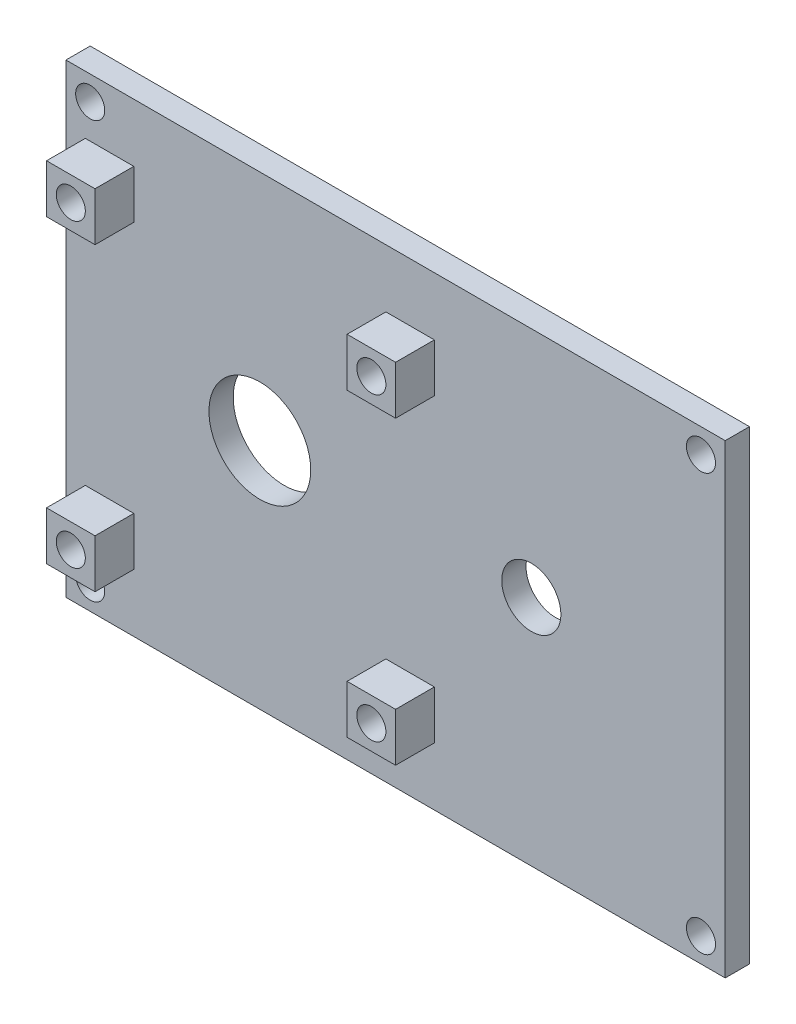
from build123d import *

# Parameters (mm, degrees)
SKICA1_R                 = 1.5
SKICA1_R_2               = 5.25
SKICA1_R_3               = 3.05
P_IDAT_VYSUNUT_M1_DEPTH  = 2.5
SKICA2_W                 = 5
SKICA2_H                 = 5
SKICA2_R                 = 1.5
P_IDAT_VYSUNUT_M2_DEPTH  = 4
ODEBRAT_START            = -2.5
SKICA5_R                 = 1.5
ODEBRAT_VYSUNUT_M1_DEPTH = 2.5
ZKOSEN_1_SIZE            = 1.5


with BuildPart() as part:
    # Skica1 → Přidat vysunutím1 (new body)
    with BuildSketch(Plane.XY):
        Polygon((-34, 9), (-34, -24), (34, -24), (34, 24), (-23.5, 24), (-34, 24), align=None)
        with Locations((-31.5, -21.5)):
            Circle(SKICA1_R, mode=Mode.SUBTRACT)
        with Locations((-14, 0)):
            Circle(SKICA1_R_2, mode=Mode.SUBTRACT)
        with Locations((31.5, -21.5)):
            Circle(SKICA1_R, mode=Mode.SUBTRACT)
        with Locations((14, 0)):
            Circle(SKICA1_R_3, mode=Mode.SUBTRACT)
        with Locations((-31.5, 21.5)):
            Circle(SKICA1_R, mode=Mode.SUBTRACT)
        with Locations((31.5, 21.5)):
            Circle(SKICA1_R, mode=Mode.SUBTRACT)
    extrude(amount=P_IDAT_VYSUNUT_M1_DEPTH)

    # Skica2 → Přidat vysunutím2 (add)
    # profile 1 of 4: a face of its own
    with BuildSketch(Plane.XY.offset(2.5)):
        with Locations((-29.5, 15.5)):
            Rectangle(SKICA2_W, SKICA2_H)
        with Locations((-29.5, 15.5)):
            Circle(SKICA2_R, mode=Mode.SUBTRACT)
    # profile 2 of 4: a face of its own
    with BuildSketch(Plane.XY.offset(2.5)):
        with Locations((1.5, 15.5)):
            Rectangle(SKICA2_W, SKICA2_H)
        with Locations((1.5, 15.5)):
            Circle(SKICA2_R, mode=Mode.SUBTRACT)
    # profile 3 of 4: a face of its own
    with BuildSketch(Plane.XY.offset(2.5)):
        with Locations((1.5, -15.5)):
            Rectangle(SKICA2_W, SKICA2_H)
        with Locations((1.5, -15.5)):
            Circle(SKICA2_R, mode=Mode.SUBTRACT)
    # profile 4 of 4: a face of its own
    with BuildSketch(Plane.XY.offset(2.5)):
        with Locations((-29.5, -15.5)):
            Rectangle(SKICA2_W, SKICA2_H)
        with Locations((-29.5, -15.5)):
            Circle(SKICA2_R, mode=Mode.SUBTRACT)
    extrude(amount=P_IDAT_VYSUNUT_M2_DEPTH)

    # Skica5 → Odebrat vysunutím1 (cut)
    with BuildSketch(Plane.XY.offset(2.5).offset(ODEBRAT_START)):
        with Locations((-29.5, 15.5)):
            Circle(SKICA5_R)
        with Locations((1.5, 15.5)):
            Circle(SKICA5_R)
        with Locations((1.5, -15.5)):
            Circle(SKICA5_R)
        with Locations((-29.5, -15.5)):
            Circle(SKICA5_R)
    extrude(amount=ODEBRAT_VYSUNUT_M1_DEPTH, mode=Mode.SUBTRACT)

    # Zkosení1
    zkosen_1_edges = [part.edges().sort_by_distance(p)[0] for p in [
        (0, -15.5, 0),
        (-31, -15.5, 0),
        (-31, 15.5, 0),
        (0, 15.5, 0),
    ]]
    chamfer(zkosen_1_edges, length=ZKOSEN_1_SIZE)


solid = part.part
